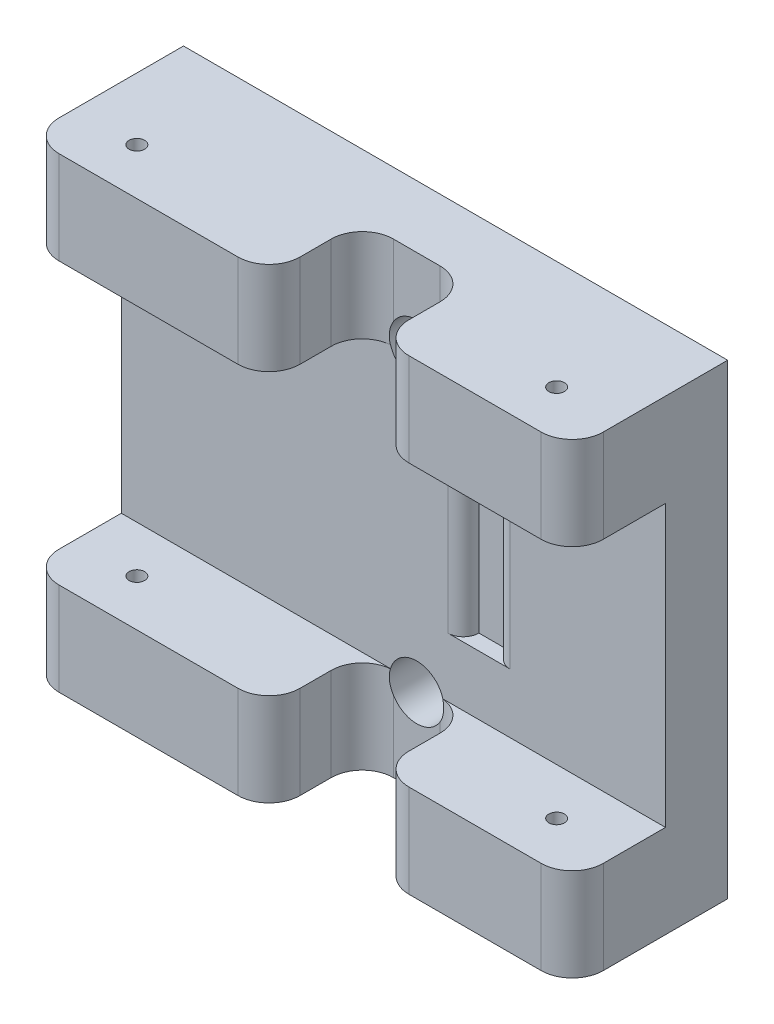
from build123d import *

# Parameters (mm, degrees)
SKETCHBUTTOM_W                   = 35
SKETCHBUTTOM_H                   = 30
BOSSEXTRUDEBUTTOM_DEPTH          = 10
CUTEXTRUDEFINGERROOM_START       = 4
CUTEXTRUDEFINGERROOM_DEPTH       = 6
FILLETTOP_R                      = 2
CUTEXTRUDEFINGERSHAFT_DEPTH      = 26.124689053
CUTEXTRUDEFINGERSHAFT_DEPTH_BACK = 26.124689053
SKETCHFINGERSHAFT_R              = 0.5
CUTEXTRUDESENSORROOM_START       = 3
SKETCH12_W                       = 2
SKETCH12_H                       = 10.4
CUTEXTRUDESENSORROOM_DEPTH       = 3
FILLETSENSORROOM_R               = 1
SKETCHFIXTUREHOLES_R             = 1.75
CUTEXTRUDEFIXTUREHOLES_DEPTH     = 5


with BuildPart() as part:
    # SketchButtom → BossExtrudeButtom (new body)
    with BuildSketch(Plane.XY):
        Rectangle(SKETCHBUTTOM_W, SKETCHBUTTOM_H)
    extrude(amount=BOSSEXTRUDEBUTTOM_DEPTH)

    # SketchFingerRoom → CutExtrudeFingerRoom (cut)
    with BuildSketch(Plane.XY.offset(CUTEXTRUDEFINGERROOM_START)):
        Polygon((5, 9.024), (17.5, 9.024), (17.5, -9.024), (5, -9.024), (5, -15), (-2, -15), (-2, -9.024), (-17.5, -9.024), (-17.5, 9.024), (-2, 9.024), (-2, 15), (5, 15), align=None)
    extrude(amount=CUTEXTRUDEFINGERROOM_DEPTH, mode=Mode.SUBTRACT)

    # FilletTop
    fillettop_edges = [part.edges().sort_by_distance(p)[0] for p in [
        (17.5, -12.012, 10),
        (-17.5, -12.012, 10),
        (17.5, 12.012, 10),
        (-2, 12.012, 4),
        (-2, -12.012, 4),
        (5, -12.012, 4),
        (5, 12.012, 4),
        (-2, 12.012, 10),
        (-2, -12.012, 10),
        (5, -12.012, 10),
        (5, 12.012, 10),
        (-17.5, 12.012, 10),
    ]]
    fillet(fillettop_edges, radius=FILLETTOP_R)

    # SketchFingerShaft → CutExtrudeFingerShaft (cut, two sides: drawn at the far end of the back side and taken through both)
    with BuildSketch(Plane(origin=(0, 0, 0), x_dir=(1, 0, 0), z_dir=(0, 1, 0)).offset(-CUTEXTRUDEFINGERSHAFT_DEPTH_BACK)):
        with Locations(Location((-13.5, -7, 0), (0, 0, 270))):
            Circle(SKETCHFINGERSHAFT_R)
        with Locations(Location((13.5, -7, 0), (0, 0, 270))):
            Circle(SKETCHFINGERSHAFT_R)
    extrude(amount=CUTEXTRUDEFINGERSHAFT_DEPTH + CUTEXTRUDEFINGERSHAFT_DEPTH_BACK, mode=Mode.SUBTRACT)

    # Sketch12 → CutExtrudeSensorRoom (cut)
    with BuildSketch(Plane.XY.offset(CUTEXTRUDESENSORROOM_START)):
        with Locations((5.5, 0)):
            Rectangle(SKETCH12_W, SKETCH12_H)
    extrude(amount=CUTEXTRUDESENSORROOM_DEPTH, mode=Mode.SUBTRACT)

    # FilletSensorRoom
    filletsensorroom_edges = [part.edges().sort_by_distance(p)[0] for p in [
        (4.5, 0, 4),
        (6.5, 0, 4),
    ]]
    fillet(filletsensorroom_edges, radius=FILLETSENSORROOM_R - 0.0001)  # a hair under: the kernel refuses the full size

    # SketchFixtureHoles → CutExtrudeFixtureHoles (cut, symmetric)
    with BuildSketch(Plane.XY):
        with Locations(Location((1.5, -9.5, 0), (0, 0, 15.783313229))):
            Circle(SKETCHFIXTUREHOLES_R)
        with Locations(Location((1.5, 9.5, 0), (0, 0, 344.216686771))):
            Circle(SKETCHFIXTUREHOLES_R)
    extrude(amount=CUTEXTRUDEFIXTUREHOLES_DEPTH, both=True, mode=Mode.SUBTRACT)


solid = part.part
